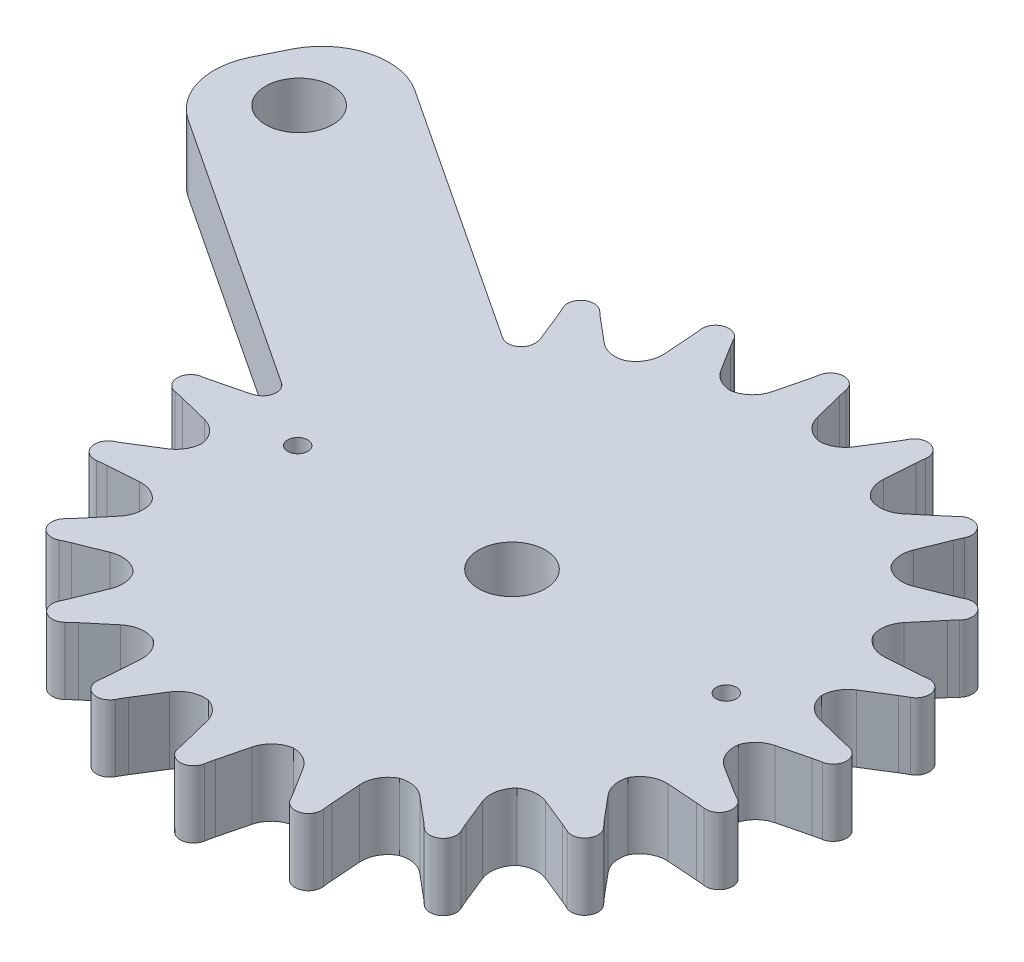
from build123d import *

# Parameters (mm, degrees)
SKETCH1_R           = 20
BOSS_EXTRUDE1_DEPTH = 5
BOSS_EXTRUDE2_START = -5
BOSS_EXTRUDE2_DEPTH = 5
FILLET1_R           = 2
CIRPATTERN1_DEPTH   = 5
SKETCH3_R           = 0.75
CUT_EXTRUDE1_DEPTH  = 5
SKETCH4_R           = 2.5
BOSS_EXTRUDE3_DEPTH = 5
FILLET2_R           = 5
FILLET3_R           = 1
SKETCH5_R           = 2.5
CUT_EXTRUDE2_DEPTH  = 5


# Read off the part's stored shape, not the designer's step: CirPattern1
with BuildPart() as part:
    # Sketch1 → Boss-Extrude1 (new body)
    with BuildSketch(Plane(origin=(0, 0, 0), x_dir=(1, 0, 0), z_dir=(0, 1, 0))):
        with Locations(Location((0, 0, 0), (0, 0, 270))):
            Circle(SKETCH1_R)
    extrude(amount=BOSS_EXTRUDE1_DEPTH)

    # Sketch2 → Boss-Extrude2 (add)
    with BuildSketch(Plane(origin=(0, 5, 0), x_dir=(1, 0, 0), z_dir=(0, 1, 0)).offset(BOSS_EXTRUDE2_START)):
        with BuildLine():
            Line((-2.105791814, 19.888832063), (-1.238592318, 23.357630049))
            ThreePointArc((-1.238592318, 23.357630049), (-1.158488111, 23.704119695), (-1.090754777, 24.053238521))
            ThreePointArc((-1.090754777, 24.053238521), (-0.109023339, 24.880258639), (0.877972386, 24.059528275))
            ThreePointArc((0.877972386, 24.059528275), (0.941143779, 23.742067411), (1.014556469, 23.426817347))
            Line((1.014556469, 23.426817347), (1.893724984, 19.910143286))
            ThreePointArc((1.893724984, 19.910143286), (-0.106567477, 19.999716082), (-2.105791814, 19.888832063))
        make_face()
    extrude(amount=BOSS_EXTRUDE2_DEPTH)

    # Fillet1
    fillet1_edges = [part.edges().sort_by_distance(p)[0] for p in [
        (1.893724984, 2.5, -19.910143286),
        (-2.105791814, 2.5, -19.888832063),
    ]]
    fillet(fillet1_edges, radius=FILLET1_R)

    # CirPattern1 outline → CirPattern1 (add)
    with BuildSketch(Plane(origin=(0, 0, 0), x_dir=(1, 0, 0), z_dir=(0, 1, 0))):
        with BuildLine():
            ThreePointArc((-18.818349161, -15.020578024), (-18.496093443, -14.870168545), (-18.16869336, -14.731312705))
            Line((-18.16869336, -14.731312705), (-16.10451314, -13.898848252))
            ThreePointArc((-16.10451314, -13.898848252), (-14.969635701, -13.791456908), (-13.960430105, -14.321535926))
            ThreePointArc((-13.960430105, -14.321535926), (-16.121714854, -11.835975249), (-17.845731798, -9.029388491))
            ThreePointArc((-17.845731798, -9.029388491), (-17.643410931, -10.160914391), (-18.097403186, -11.216933153))
            Line((-18.097403186, -11.216933153), (-19.549034688, -12.94914432))
            ThreePointArc((-19.549034688, -12.94914432), (-19.760926451, -13.193835771), (-19.980626471, -13.431541317))
            ThreePointArc((-19.980626471, -13.431541317), (-20.064469753, -14.712450836), (-18.818349161, -15.020578024))
        make_face()
        with BuildLine():
            ThreePointArc((-8.242021953, 19.611282475), (-8.490583131, 18.498764143), (-9.306579914, 17.702756009))
            ThreePointArc((-9.306579914, 17.702756009), (-6.422679306, 18.940675556), (-3.380631018, 19.712212811))
            ThreePointArc((-3.380631018, 19.712212811), (-4.340011374, 19.966775936), (-5.058856916, 20.651227642))
            Line((-5.058856916, 20.651227642), (-6.274384144, 22.593742485))
            ThreePointArc((-6.274384144, 22.593742485), (-6.441621387, 22.870877344), (-6.599801755, 23.153279533))
            ThreePointArc((-6.599801755, 23.153279533), (-7.792110102, 23.628842042), (-8.470228911, 22.53892747))
            ThreePointArc((-8.470228911, 22.53892747), (-8.42676349, 22.185964985), (-8.395875928, 21.831680188))
            Line((-8.395875928, 21.831680188), (-8.242021953, 19.611282475))
        make_face()
        with BuildLine():
            ThreePointArc((-13.898848252, 16.10451314), (-13.791456908, 14.969635701), (-14.321535926, 13.960430105))
            ThreePointArc((-14.321535926, 13.960430105), (-11.961321637, 16.028935855), (-9.306579913, 17.702756008))
            ThreePointArc((-9.306579913, 17.702756008), (-10.297669185, 17.648395093), (-11.192839131, 18.077211859))
            Line((-11.192839131, 18.077211859), (-12.94914432, 19.549034688))
            ThreePointArc((-12.94914432, 19.549034688), (-13.193835771, 19.760926451), (-13.431541317, 19.980626471))
            ThreePointArc((-13.431541317, 19.980626471), (-14.712450836, 20.064469753), (-15.020578024, 18.818349161))
            ThreePointArc((-15.020578024, 18.818349161), (-14.870168545, 18.496093443), (-14.731312705, 18.16869336))
            Line((-14.731312705, 18.16869336), (-13.898848252, 16.10451314))
        make_face()
        with BuildLine():
            ThreePointArc((-18.195158445, 11.021321851), (-17.742326793, 9.975175019), (-17.934600217, 8.851560036))
            ThreePointArc((-17.934600217, 8.851560036), (-16.329106467, 11.548172233), (-14.321535925, 13.960430104))
            ThreePointArc((-14.321535925, 13.960430104), (-15.247319388, 13.602466375), (-16.231188267, 13.733672628))
            Line((-16.231188267, 13.733672628), (-18.356352028, 14.59073117))
            ThreePointArc((-18.356352028, 14.59073117), (-18.654545583, 14.716638395), (-18.948508031, 14.852130478))
            ThreePointArc((-18.948508031, 14.852130478), (-20.192634375, 14.536047367), (-20.100608305, 13.255699721))
            ThreePointArc((-20.100608305, 13.255699721), (-19.857977897, 12.995695406), (-19.624745956, 12.727228237))
            Line((-19.624745956, 12.727228237), (-18.195158445, 11.021321851))
        make_face()
        with BuildLine():
            ThreePointArc((-20.710399757, 4.85928679), (-19.956454114, 4.004274704), (-19.792100881, 2.876237597))
            ThreePointArc((-19.792100881, 2.876237597), (-19.098484585, 5.936993052), (-17.934600215, 8.851560035))
            ThreePointArc((-17.934600215, 8.851560035), (-18.704455735, 8.225033474), (-19.680715605, 8.045785833))
            Line((-19.680715605, 8.045785833), (-21.966712103, 8.204185225))
            ThreePointArc((-21.966712103, 8.204185225), (-22.289218499, 8.231783236), (-22.610662757, 8.269804472))
            ThreePointArc((-22.610662757, 8.269804472), (-23.696222171, 7.584735387), (-23.213050996, 6.395490034))
            ThreePointArc((-23.213050996, 6.395490034), (-22.901950013, 6.223188155), (-22.597172338, 6.039933339))
            Line((-22.597172338, 6.039933339), (-20.710399757, 4.85928679))
        make_face()
        with BuildLine():
            ThreePointArc((-21.198362842, -1.778409119), (-20.217104661, -2.358591919), (-19.712212811, -3.380631018))
            ThreePointArc((-19.712212811, -3.380631018), (-19.998369964, -0.255340374), (-19.792100879, 2.876237597))
            ThreePointArc((-19.792100879, 2.876237597), (-20.330669633, 2.042476989), (-21.203757377, 1.570321461))
            Line((-21.203757377, 1.570321461), (-23.426817347, 1.014556469))
            ThreePointArc((-23.426817347, 1.014556469), (-23.74206741, 0.941143779), (-24.059528275, 0.877972386))
            ThreePointArc((-24.059528275, 0.877972386), (-24.880258639, -0.109023339), (-24.053238521, -1.090754777))
            ThreePointArc((-24.053238521, -1.090754777), (-23.704119695, -1.158488111), (-23.357630049, -1.238592318))
            Line((-23.357630049, -1.238592318), (-21.198362842, -1.778409119))
        make_face()
        with BuildLine():
            ThreePointArc((-19.579720151, -8.239834962), (-18.612665626, -8.414862877), (-17.845731799, -9.029388492))
            ThreePointArc((-17.845731799, -9.029388492), (-18.990179463, -6.274797518), (-19.71221281, -3.380631018))
            ThreePointArc((-19.71221281, -3.380631018), (-19.966775936, -4.340011374), (-20.651227642, -5.058856916))
            Line((-20.651227642, -5.058856916), (-22.593742485, -6.274384144))
            ThreePointArc((-22.593742485, -6.274384144), (-22.870877344, -6.441621387), (-23.153279533, -6.599801755))
            ThreePointArc((-23.153279533, -6.599801755), (-23.628842042, -7.792110102), (-22.53892747, -8.470228911))
            ThreePointArc((-22.53892747, -8.470228911), (-22.185964985, -8.42676349), (-21.831680188, -8.395875928))
            Line((-21.831680188, -8.395875928), (-19.579720151, -8.239834962))
        make_face()
        with BuildLine():
            ThreePointArc((3.184529229, 19.744841696), (6.085729599, 19.051611356), (8.851560036, 17.934600217))
            ThreePointArc((8.851560036, 17.934600217), (8.225033474, 18.704455735), (8.045785833, 19.680715605))
            Line((8.045785833, 19.680715605), (8.204185225, 21.966712103))
            ThreePointArc((8.204185225, 21.966712103), (8.231783236, 22.289218499), (8.269804472, 22.610662757))
            ThreePointArc((8.269804472, 22.610662757), (7.584735387, 23.696222171), (6.395490034, 23.213050996))
            ThreePointArc((6.395490034, 23.213050996), (6.223188155, 22.901950013), (6.039933339, 22.597172338))
            Line((6.039933339, 22.597172338), (4.842504233, 20.683579819))
            ThreePointArc((4.842504233, 20.683579819), (4.132483288, 20.004095101), (3.184529229, 19.744841696))
        make_face()
        with BuildLine():
            ThreePointArc((8.851560036, 17.934600217), (11.548172234, 16.329106469), (13.960430106, 14.321535927))
            ThreePointArc((13.960430106, 14.321535927), (13.602466375, 15.247319388), (13.733672628, 16.231188267))
            Line((13.733672628, 16.231188267), (14.59073117, 18.356352028))
            ThreePointArc((14.59073117, 18.356352028), (14.716638395, 18.654545583), (14.852130478, 18.948508031))
            ThreePointArc((14.852130478, 18.948508031), (14.536047367, 20.192634375), (13.255699721, 20.100608305))
            ThreePointArc((13.255699721, 20.100608305), (12.995695406, 19.857977897), (12.727228237, 19.624745956))
            Line((12.727228237, 19.624745956), (11.021321851, 18.195158445))
            ThreePointArc((11.021321851, 18.195158445), (9.975175019, 17.742326793), (8.851560036, 17.934600217))
        make_face()
        with BuildLine():
            ThreePointArc((13.960430106, 14.321535927), (16.028935857, 11.961321639), (17.70275601, 9.306579915))
            ThreePointArc((17.70275601, 9.306579915), (17.648395093, 10.297669185), (18.077211859, 11.192839131))
            Line((18.077211859, 11.192839131), (19.549034688, 12.94914432))
            ThreePointArc((19.549034688, 12.94914432), (19.760926451, 13.193835771), (19.980626471, 13.431541317))
            ThreePointArc((19.980626471, 13.431541317), (20.064469753, 14.712450836), (18.818349161, 15.020578024))
            ThreePointArc((18.818349161, 15.020578024), (18.496093443, 14.870168545), (18.16869336, 14.731312705))
            Line((18.16869336, 14.731312705), (16.10451314, 13.898848252))
            ThreePointArc((16.10451314, 13.898848252), (14.969635701, 13.791456908), (13.960430106, 14.321535927))
        make_face()
        with BuildLine():
            ThreePointArc((17.70275601, 9.306579915), (18.940675558, 6.422679307), (19.712212813, 3.380631018))
            ThreePointArc((19.712212813, 3.380631018), (19.966775936, 4.340011374), (20.651227642, 5.058856916))
            Line((20.651227642, 5.058856916), (22.593742485, 6.274384144))
            ThreePointArc((22.593742485, 6.274384144), (22.870877344, 6.441621387), (23.153279533, 6.599801755))
            ThreePointArc((23.153279533, 6.599801755), (23.628842042, 7.792110102), (22.53892747, 8.470228911))
            ThreePointArc((22.53892747, 8.470228911), (22.185964985, 8.42676349), (21.831680188, 8.395875928))
            Line((21.831680188, 8.395875928), (19.611282475, 8.242021953))
            ThreePointArc((19.611282475, 8.242021953), (18.498764143, 8.490583131), (17.70275601, 9.306579915))
        make_face()
        with BuildLine():
            ThreePointArc((19.712212813, 3.380631018), (19.998369968, 0.255340374), (19.792100883, -2.876237597))
            ThreePointArc((19.792100883, -2.876237597), (20.330669633, -2.042476989), (21.203757377, -1.570321461))
            Line((21.203757377, -1.570321461), (23.426817347, -1.014556469))
            ThreePointArc((23.426817347, -1.014556469), (23.74206741, -0.941143779), (24.059528275, -0.877972386))
            ThreePointArc((24.059528275, -0.877972386), (24.880258639, 0.109023339), (24.053238521, 1.090754777))
            ThreePointArc((24.053238521, 1.090754777), (23.704119695, 1.158488111), (23.357630049, 1.238592318))
            Line((23.357630049, 1.238592318), (21.198362842, 1.778409119))
            ThreePointArc((21.198362842, 1.778409119), (20.217104661, 2.358591919), (19.712212813, 3.380631018))
        make_face()
        with BuildLine():
            ThreePointArc((19.792100883, -2.876237597), (19.051611357, -6.085729599), (17.794386708, -9.130158911))
            ThreePointArc((17.794386708, -9.130158911), (18.590889166, -8.301383653), (19.712076244, -8.047958848))
            Line((19.712076244, -8.047958848), (21.966712103, -8.204185225))
            ThreePointArc((21.966712103, -8.204185225), (22.289218499, -8.231783236), (22.610662757, -8.269804472))
            ThreePointArc((22.610662757, -8.269804472), (23.696222171, -7.584735387), (23.213050996, -6.395490034))
            ThreePointArc((23.213050996, -6.395490034), (22.901950013, -6.223188155), (22.597172338, -6.039933339))
            Line((22.597172338, -6.039933339), (20.710399757, -4.85928679))
            ThreePointArc((20.710399757, -4.85928679), (19.956454114, -4.004274704), (19.792100883, -2.876237597))
        make_face()
        with BuildLine():
            ThreePointArc((17.794386708, -9.130158911), (16.238565258, -11.675144471), (14.321535927, -13.960430106))
            ThreePointArc((14.321535927, -13.960430106), (15.247319388, -13.602466375), (16.231188267, -13.733672628))
            Line((16.231188267, -13.733672628), (18.356352028, -14.59073117))
            ThreePointArc((18.356352028, -14.59073117), (18.654545583, -14.716638395), (18.948508031, -14.852130478))
            ThreePointArc((18.948508031, -14.852130478), (20.192634375, -14.536047367), (20.100608305, -13.255699721))
            ThreePointArc((20.100608305, -13.255699721), (19.857977897, -12.995695406), (19.624745956, -12.727228237))
            Line((19.624745956, -12.727228237), (18.174837264, -10.997072875))
            ThreePointArc((18.174837264, -10.997072875), (17.748017433, -10.111830503), (17.794386708, -9.130158911))
        make_face()
        with BuildLine():
            ThreePointArc((14.321535927, -13.960430106), (11.961321639, -16.028935857), (9.306579914, -17.70275601))
            ThreePointArc((9.306579914, -17.70275601), (10.297669185, -17.648395093), (11.192839131, -18.077211859))
            Line((11.192839131, -18.077211859), (12.94914432, -19.549034688))
            ThreePointArc((12.94914432, -19.549034688), (13.193835771, -19.760926451), (13.431541317, -19.980626471))
            ThreePointArc((13.431541317, -19.980626471), (14.712450836, -20.064469753), (15.020578024, -18.818349161))
            ThreePointArc((15.020578024, -18.818349161), (14.870168545, -18.496093443), (14.731312705, -18.16869336))
            Line((14.731312705, -18.16869336), (13.898848252, -16.10451314))
            ThreePointArc((13.898848252, -16.10451314), (13.791456908, -14.969635701), (14.321535927, -13.960430106))
        make_face()
        with BuildLine():
            ThreePointArc((9.306579914, -17.70275601), (6.422679306, -18.940675557), (3.380631018, -19.712212812))
            ThreePointArc((3.380631018, -19.712212812), (4.340011374, -19.966775936), (5.058856916, -20.651227642))
            Line((5.058856916, -20.651227642), (6.274384144, -22.593742485))
            ThreePointArc((6.274384144, -22.593742485), (6.441621387, -22.870877344), (6.599801755, -23.153279533))
            ThreePointArc((6.599801755, -23.153279533), (7.792110102, -23.628842042), (8.470228911, -22.53892747))
            ThreePointArc((8.470228911, -22.53892747), (8.42676349, -22.185964985), (8.395875928, -21.831680188))
            Line((8.395875928, -21.831680188), (8.242021953, -19.611282475))
            ThreePointArc((8.242021953, -19.611282475), (8.490583131, -18.498764143), (9.306579914, -17.70275601))
        make_face()
        with BuildLine():
            ThreePointArc((3.380631018, -19.712212812), (0.255340374, -19.998369966), (-2.876237597, -19.792100881))
            ThreePointArc((-2.876237597, -19.792100881), (-2.042476989, -20.330669633), (-1.570321461, -21.203757377))
            Line((-1.570321461, -21.203757377), (-1.014556469, -23.426817347))
            ThreePointArc((-1.014556469, -23.426817347), (-0.941143779, -23.74206741), (-0.877972386, -24.059528275))
            ThreePointArc((-0.877972386, -24.059528275), (0.109023339, -24.880258639), (1.090754777, -24.053238521))
            ThreePointArc((1.090754777, -24.053238521), (1.158488111, -23.704119695), (1.238592318, -23.357630049))
            Line((1.238592318, -23.357630049), (1.778409119, -21.198362842))
            ThreePointArc((1.778409119, -21.198362842), (2.358591919, -20.217104661), (3.380631018, -19.712212812))
        make_face()
        with BuildLine():
            ThreePointArc((-2.876237597, -19.792100881), (-5.936993053, -19.098484586), (-8.851560035, -17.934600216))
            ThreePointArc((-8.851560035, -17.934600216), (-8.225033474, -18.704455735), (-8.045785833, -19.680715605))
            Line((-8.045785833, -19.680715605), (-8.204185225, -21.966712103))
            ThreePointArc((-8.204185225, -21.966712103), (-8.231783236, -22.289218499), (-8.269804472, -22.610662757))
            ThreePointArc((-8.269804472, -22.610662757), (-7.584735387, -23.696222171), (-6.395490034, -23.213050996))
            ThreePointArc((-6.395490034, -23.213050996), (-6.223188155, -22.901950013), (-6.039933339, -22.597172338))
            Line((-6.039933339, -22.597172338), (-4.85928679, -20.710399757))
            ThreePointArc((-4.85928679, -20.710399757), (-4.004274704, -19.956454114), (-2.876237597, -19.792100881))
        make_face()
        with BuildLine():
            ThreePointArc((-8.851560035, -17.934600216), (-11.548172233, -16.329106468), (-13.960430104, -14.321535925))
            ThreePointArc((-13.960430104, -14.321535925), (-13.602466375, -15.247319388), (-13.733672628, -16.231188267))
            Line((-13.733672628, -16.231188267), (-14.59073117, -18.356352028))
            ThreePointArc((-14.59073117, -18.356352028), (-14.716638395, -18.654545583), (-14.852130478, -18.948508031))
            ThreePointArc((-14.852130478, -18.948508031), (-14.536047367, -20.192634375), (-13.255699721, -20.100608305))
            ThreePointArc((-13.255699721, -20.100608305), (-12.995695406, -19.857977897), (-12.727228237, -19.624745956))
            Line((-12.727228237, -19.624745956), (-11.021321851, -18.195158445))
            ThreePointArc((-11.021321851, -18.195158445), (-9.975175019, -17.742326793), (-8.851560035, -17.934600216))
        make_face()
    extrude(amount=CIRPATTERN1_DEPTH)

    # Sketch3 → Cut-Extrude1 (cut)
    with BuildSketch(Plane(origin=(0, 5, 0), x_dir=(1, 0, 0), z_dir=(0, 1, 0))):
        with Locations(Location((-16, 0, 0), (0, 0, 270))):
            Circle(SKETCH3_R)
        with Locations(Location((16, 0, 0), (0, 0, 90))):
            Circle(SKETCH3_R)
    extrude(amount=-CUT_EXTRUDE1_DEPTH, mode=Mode.SUBTRACT)

    # Sketch4 → Boss-Extrude3 (add)
    with BuildSketch(Plane.XZ):
        Polygon((-19.792100881, -2.876237597), (-44.829083623, -19.40347255), (-39.358518667, -30.487665059), (-14.321535926, -13.960430105), align=None)
        with Locations(Location((-37.947106751, -22.049955634, 0), (0, 0, 270))):
            Circle(SKETCH4_R, mode=Mode.SUBTRACT)
    extrude(amount=-BOSS_EXTRUDE3_DEPTH)

    # Fillet2
    fillet2_edges = [part.edges().sort_by_distance(p)[0] for p in [
        (-39.358518667, 2.5, -30.487665059),
        (-44.829083623, 2.5, -19.40347255),
    ]]
    fillet(fillet2_edges, radius=FILLET2_R)

    # Fillet3
    fillet3_edges = [part.edges().sort_by_distance(p)[0] for p in [
        (-14.321535926, 2.5, -13.960430105),
        (-19.792100881, 2.5, -2.876237597),
    ]]
    fillet(fillet3_edges, radius=FILLET3_R)

    # Sketch5 → Cut-Extrude2 (cut)
    with BuildSketch(Plane.XZ):
        with Locations(Location((0, 0, 0), (0, 0, 270))):
            Circle(SKETCH5_R)
    extrude(amount=-CUT_EXTRUDE2_DEPTH, mode=Mode.SUBTRACT)


solid = part.part
